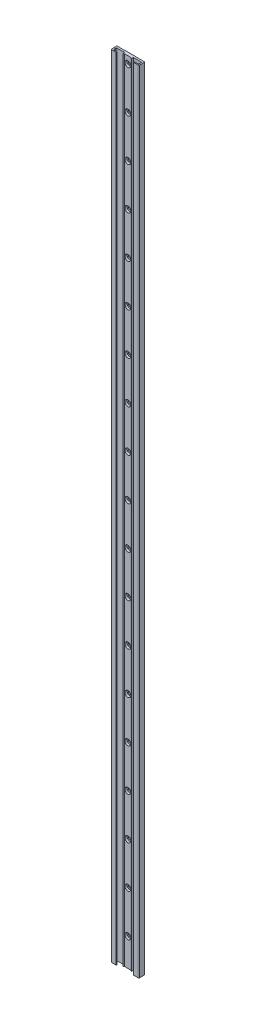
from build123d import *

# Parameters (mm, degrees)
SKETCH1_W                                        = 40
SKETCH1_H                                        = 1130.3
BOSS_EXTRUDE1_DEPTH                              = 8.7
CUT_EXTRUDE1_DEPTH                               = 1131.510406852
SKETCH3_W                                        = 12
SKETCH3_H                                        = 0.2
CUT_EXTRUDE2_DEPTH                               = 1131.510406852
SKETCH4_W                                        = 12
SKETCH4_H                                        = 0.2
CUT_EXTRUDE3_DEPTH                               = 1131.510406852
DRAFT1_ANGLE                                     = 45
CBORE_FOR_M4_HEX_HEAD_MACHINE_SCREW1_D           = 4.5
CBORE_FOR_M4_HEX_HEAD_MACHINE_SCREW1_DEPTH       = 4.5
CBORE_FOR_M4_HEX_HEAD_MACHINE_SCREW1_CBORE_D     = 8.5
CBORE_FOR_M4_HEX_HEAD_MACHINE_SCREW1_CBORE_DEPTH = 3.1
FILLET1_R                                        = 0.5
FILLET2_R                                        = 1


with BuildPart() as part:
    # Sketch1 → Boss-Extrude1 (new body)
    with BuildSketch(Plane.XY.offset(8.7)):
        with Locations((0, 565.15)):
            Rectangle(SKETCH1_W, SKETCH1_H)
    extrude(amount=-BOSS_EXTRUDE1_DEPTH)

    # Sketch2 → Cut-Extrude1 (cut, through all)
    with BuildSketch(Plane.XZ):
        Polygon((12.5, 8.7), (-12.5, 8.7), (-12.5, 7.2), (-18, 7.2), (-18, 2.8), (-6.3, 2.8), (-6.3, 5.5), (-4.75, 5.5), (-4.75, 4.5), (4.75, 4.5), (4.75, 5.5), (6.3, 5.5), (6.3, 2.8), (18, 2.8), (18, 7.2), (12.5, 7.2), align=None)
    extrude(amount=-CUT_EXTRUDE1_DEPTH, mode=Mode.SUBTRACT)

    # Sketch3 → Cut-Extrude2 (cut, through all)
    with BuildSketch(Plane.XZ):
        with Locations((14, 0.1)):
            Rectangle(SKETCH3_W, SKETCH3_H)
    extrude(amount=-CUT_EXTRUDE2_DEPTH, mode=Mode.SUBTRACT)

    # Sketch4 → Cut-Extrude3 (cut, through all)
    with BuildSketch(Plane.XZ):
        with Locations((-14, 0.1)):
            Rectangle(SKETCH4_W, SKETCH4_H)
    extrude(amount=-CUT_EXTRUDE3_DEPTH, mode=Mode.SUBTRACT)

    # Draft1
    draft1_faces = [part.faces().sort_by_distance(p)[0] for p in [
        (4.75, 565.15, 5),
        (-4.75, 565.15, 5),
    ]]
    draft(draft1_faces, Plane(origin=(-4.75, 1130.3, 4.5), x_dir=(1, 0, 0), z_dir=(0, 0, 1)), DRAFT1_ANGLE)

    # CBORE for M4 Hex Head Machine Screw1
    with Locations(Plane.XY.offset(4.5)):
        with Locations((0, 160), (0, 100), (0, 40), (0, 220), (0, 280), (0, 340), (0, 400), (0, 460), (0, 520), (0, 580), (0, 640), (0, 700), (0, 760), (0, 820), (0, 880), (0, 940), (0, 1000), (0, 1060), (0, 1120), (0, 1180)):
            CounterBoreHole(CBORE_FOR_M4_HEX_HEAD_MACHINE_SCREW1_D / 2, CBORE_FOR_M4_HEX_HEAD_MACHINE_SCREW1_CBORE_D / 2, CBORE_FOR_M4_HEX_HEAD_MACHINE_SCREW1_CBORE_DEPTH, depth=CBORE_FOR_M4_HEX_HEAD_MACHINE_SCREW1_DEPTH)

    # Fillet1
    fillet1_edges = [part.edges().sort_by_distance(p)[0] for p in [
        (-18, 565.15, 7.2),
        (-18, 565.15, 2.8),
        (-20, 565.15, 0.2),
        (18, 565.15, 7.2),
        (20, 565.15, 0.2),
        (18, 565.15, 2.8),
    ]]
    fillet(fillet1_edges, radius=FILLET1_R)

    # Fillet2
    fillet2_edges = [part.edges().sort_by_distance(p)[0] for p in [
        (20, 565.15, 8.7),
        (-20, 565.15, 8.7),
    ]]
    fillet(fillet2_edges, radius=FILLET2_R)


solid = part.part
